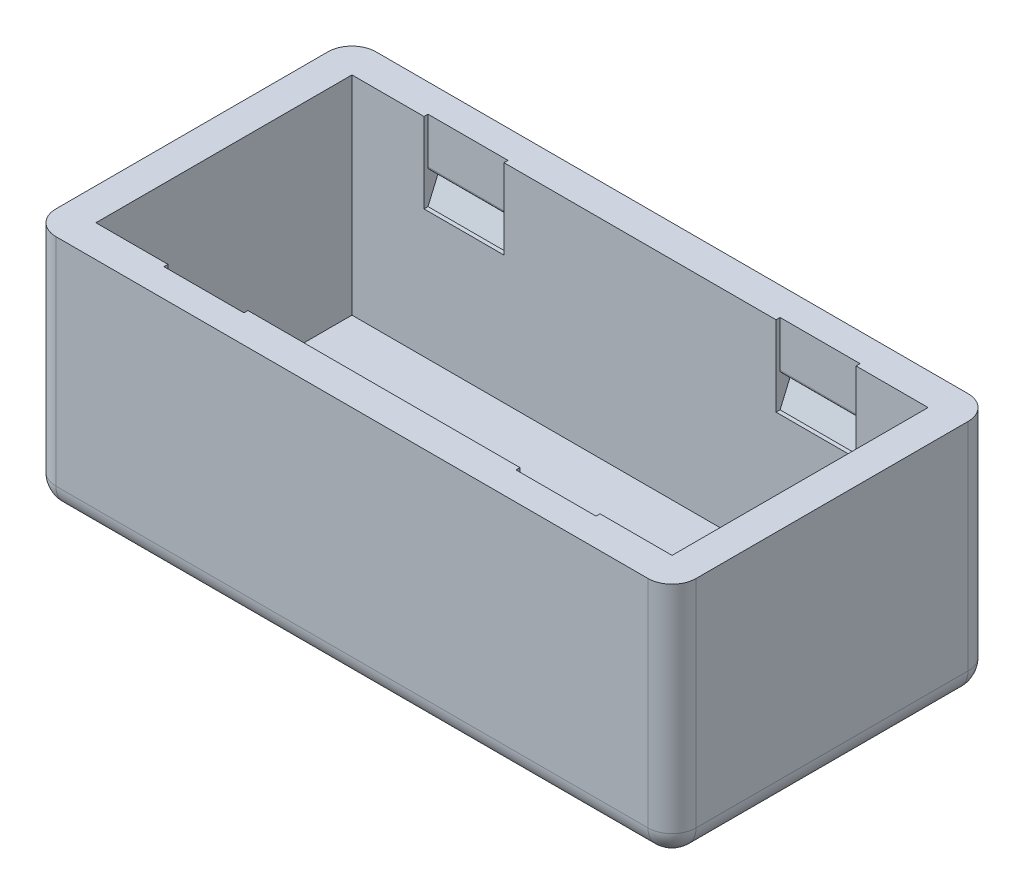
from build123d import *

# Parameters (mm, degrees)
SKETCH1_W            = 40
SKETCH1_H            = 20
BOSS_EXTRUDE1_DEPTH  = 15
SHELL2_T             = -2
CUT_EXTRUDE1_START   = -11
CUT_EXTRUDE1_DEPTH   = 2.5
MIRROR2_START        = -11
MIRROR2_COPY_1_DEPTH = 2.5
MIRROR2_COPY_2_DEPTH = 2.5
FILLET1_R            = 1.5


with BuildPart() as part:
    # Sketch1 → Boss-Extrude1 (new body)
    with BuildSketch(Plane(origin=(0, 0, 0), x_dir=(1, 0, 0), z_dir=(0, 1, 0))):
        Rectangle(SKETCH1_W, SKETCH1_H)
    extrude(amount=BOSS_EXTRUDE1_DEPTH)

    # Shell2
    shell2_openings = [part.faces().sort_by_distance(p)[0] for p in [
        (0, 15, 0),
    ]]
    offset(amount=SHELL2_T, openings=shell2_openings, kind=Kind.INTERSECTION)

    # Sketch2 → Cut-Extrude1 (cut, symmetric)
    with BuildSketch(Plane(origin=(0, 0, 0), x_dir=(0, 0, -1), z_dir=(1, 0, 0)).offset(CUT_EXTRUDE1_START)):
        with BuildLine():
            Line((8.25, 12.144151844), (8.25, 15))
            Line((8.25, 15), (8, 15))
            Line((8, 15), (8, 10))
            Line((8, 10), (8.25, 10))
            Line((8.25, 10), (9, 11.75))
            Line((9, 11.75), (8.386754447, 11.954415184))
            ThreePointArc((8.386754447, 11.954415184), (8.287751563, 12.027209787), (8.25, 12.144151844))
        make_face()
    cut_extrude1 = extrude(amount=CUT_EXTRUDE1_DEPTH, both=True, mode=Mode.SUBTRACT)

    # Mirror1: Cut-Extrude1 across plane
    add(cut_extrude1.mirror(Plane(origin=(0, 0, 0), x_dir=(0, 0, 1), z_dir=(1, 0, 0))), mode=Mode.SUBTRACT)

    # Mirror2 copy 1 sketch → Mirror2 copy 1 (cut, symmetric)
    with BuildSketch(Plane.ZY.offset(MIRROR2_START)):
        with BuildLine():
            Line((8.25, 12.144151844), (8.25, 15))
            Line((8.25, 15), (8, 15))
            Line((8, 15), (8, 10))
            Line((8, 10), (8.25, 10))
            Line((8.25, 10), (9, 11.75))
            Line((9, 11.75), (8.386754447, 11.954415184))
            ThreePointArc((8.386754447, 11.954415184), (8.287751563, 12.027209787), (8.25, 12.144151844))
        make_face()
    extrude(amount=MIRROR2_COPY_1_DEPTH, both=True, mode=Mode.SUBTRACT)

    # Mirror2 copy 2 sketch → Mirror2 copy 2 (cut, symmetric)
    with BuildSketch(Plane(origin=(0, 0, 0), x_dir=(0, 0, 1), z_dir=(1, 0, 0)).offset(MIRROR2_START)):
        with BuildLine():
            Line((8.25, -12.144151844), (8.25, -15))
            Line((8.25, -15), (8, -15))
            Line((8, -15), (8, -10))
            Line((8, -10), (8.25, -10))
            Line((8.25, -10), (9, -11.75))
            Line((9, -11.75), (8.386754447, -11.954415184))
            ThreePointArc((8.386754447, -11.954415184), (8.287751563, -12.027209787), (8.25, -12.144151844))
        make_face()
    extrude(amount=MIRROR2_COPY_2_DEPTH, both=True, mode=Mode.SUBTRACT)

    # Fillet1
    fillet1_edges = [part.edges().sort_by_distance(p)[0] for p in [
        (0, 0, -10),
        (-20, 0, 0),
        (0, 0, 10),
        (20, 0, 0),
        (-20, 7.5, -10),
        (20, 7.5, -10),
        (20, 7.5, 10),
        (-20, 7.5, 10),
    ]]
    fillet(fillet1_edges, radius=FILLET1_R)


solid = part.part
